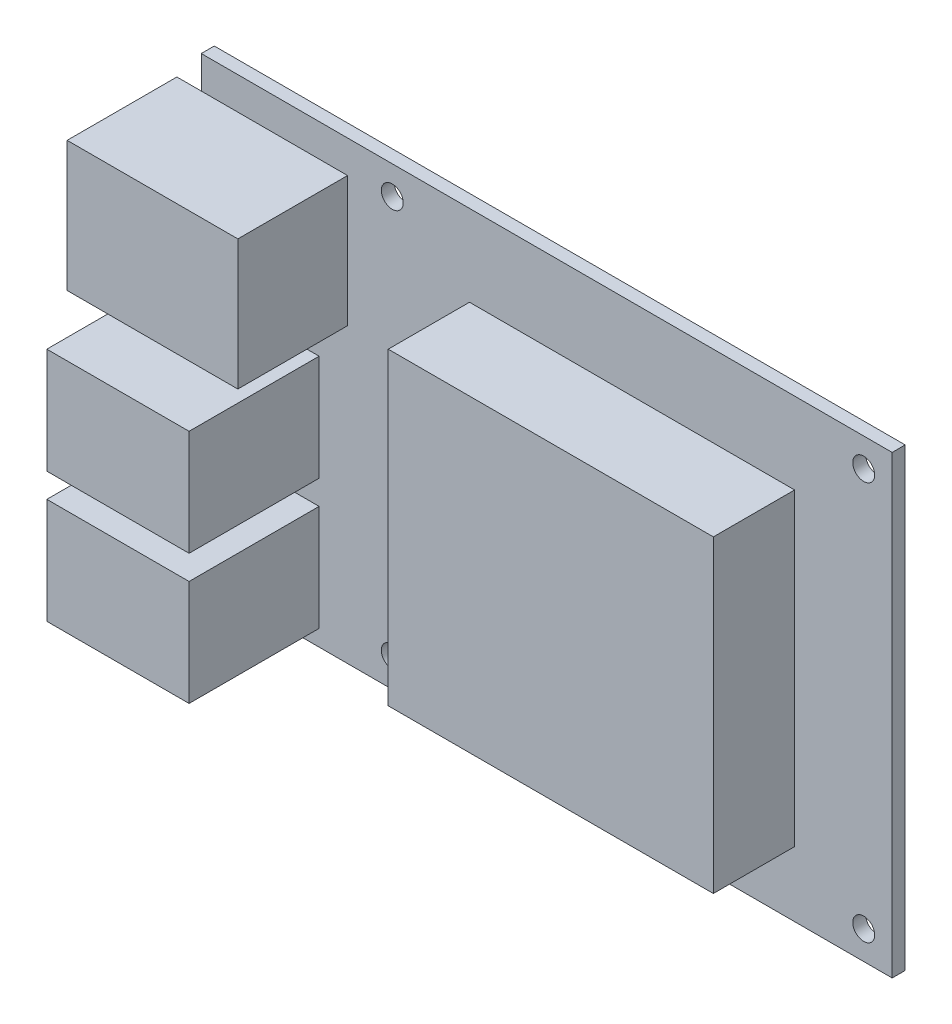
from build123d import *

# Parameters (mm, degrees)
PCB_START                  = -40
SK_PCB_W                   = 85
SK_PCB_H                   = 56
PCB_DEPTH                  = 1.6
BARRENOS_M2_5_START        = -40
SK_BARRENOS_M2_5_R         = 1.35
BARRENOS_M2_5_DEPTH        = 1.6
ETHERNET_START             = -38.4
SK_ETHERNET_W              = 21
SK_ETHERNET_H              = 16
ETHERNET_DEPTH             = 13.5
USB_START                  = -38.4
SK_USB_W                   = 17.5
SK_USB_H                   = 13
USB_DEPTH                  = 16
DISIPADOR_VENTILADOR_START = -38.4
SK_DISIPADOR_VENTILADOR_W  = 40
SK_DISIPADOR_VENTILADOR_H  = 38
DISIPADOR_VENTILADOR_DEPTH = 10


with BuildPart() as part:
    # Sk_PCB → PCB (new body)
    with BuildSketch(Plane.XY.offset(PCB_START)):
        with Locations((-52.5, 0)):
            Rectangle(SK_PCB_W, SK_PCB_H)
    extrude(amount=PCB_DEPTH)

    # Sk_Barrenos_M2-5 → Barrenos_M2-5 (cut)
    with BuildSketch(Plane.XY.offset(BARRENOS_M2_5_START)):
        with Locations((-13.5, -24.5)):
            Circle(SK_BARRENOS_M2_5_R)
        with Locations((-13.5, 24.5)):
            Circle(SK_BARRENOS_M2_5_R)
        with Locations((-71.5, -24.5)):
            Circle(SK_BARRENOS_M2_5_R)
        with Locations((-71.5, 24.5)):
            Circle(SK_BARRENOS_M2_5_R)
    extrude(amount=BARRENOS_M2_5_DEPTH, mode=Mode.SUBTRACT)

    # Sk_Ethernet → Ethernet (add)
    with BuildSketch(Plane.XY.offset(ETHERNET_START)):
        with Locations((-87.5, 16)):
            Rectangle(SK_ETHERNET_W, SK_ETHERNET_H)
    extrude(amount=ETHERNET_DEPTH)

    # Sk_USB → USB (add)
    with BuildSketch(Plane.XY.offset(USB_START)):
        with Locations((-89.25, -19.5)):
            Rectangle(SK_USB_W, SK_USB_H)
        with Locations((-89.25, -3.5)):
            Rectangle(SK_USB_W, SK_USB_H)
    extrude(amount=USB_DEPTH)

    # Sk_Disipador_ventilador → Disipador_ventilador (add)
    with BuildSketch(Plane.XY.offset(DISIPADOR_VENTILADOR_START)):
        with Locations((-42, -1)):
            Rectangle(SK_DISIPADOR_VENTILADOR_W, SK_DISIPADOR_VENTILADOR_H)
    extrude(amount=DISIPADOR_VENTILADOR_DEPTH)


solid = part.part
